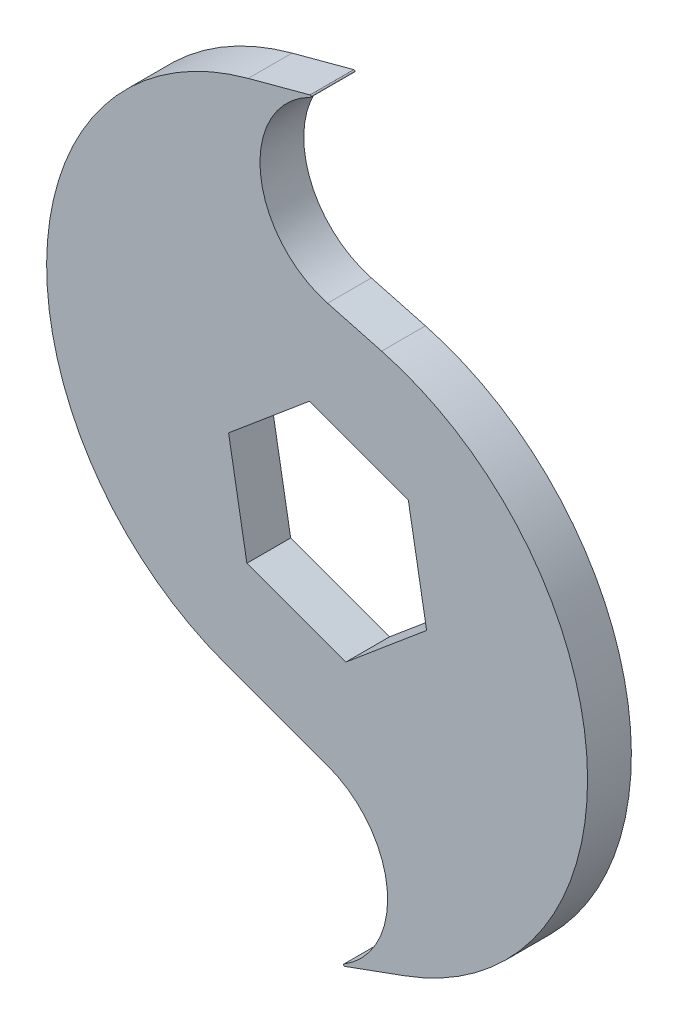
from build123d import *

# Parameters (mm, degrees)
BOSS_EXTRUDE1_DEPTH = 3.048
FILLET1_R           = 0.127


with BuildPart() as part:
    # Sketch1 → Boss-Extrude1 (new, symmetric)
    with BuildSketch(Plane.XY):
        with BuildLine():
            Line((0, 52.07), (-11.040532194, 49.111698314))
            ThreePointArc((-11.040532194, 49.111698314), (-39.066320922, 14.192289272), (-14.190605813, -23.03684931))
            Line((-14.190605813, -23.03684931), (0, -28.201807432))
            ThreePointArc((0, -28.201807432), (8.35634418, -40.135903716), (0, -52.07))
            Line((0, -52.07), (10.740686656, -48.160709762))
            ThreePointArc((10.740686656, -48.160709762), (36.144496882, -10.141220984), (7.52373904, 25.519504212))
            Line((7.52373904, 25.519504212), (0, 27.535484012))
            ThreePointArc((0, 27.535484012), (-9.412998127, 39.802742006), (0, 52.07))
        make_face()
        Polygon((-2.546497882, 14.441907141), (-13.780307404, 5.015621714), (-11.233809522, -9.426285427), (2.546497882, -14.441907141), (13.780307404, -5.015621714), (11.233809522, 9.426285427), align=None, mode=Mode.SUBTRACT)
    extrude(amount=BOSS_EXTRUDE1_DEPTH, both=True)

    # Fillet1
    fillet1_edges = [part.edges().sort_by_distance(p)[0] for p in [
        (0, 52.07, 0),
        (0, -52.07, 0),
    ]]
    fillet(fillet1_edges, radius=FILLET1_R)


solid = part.part
